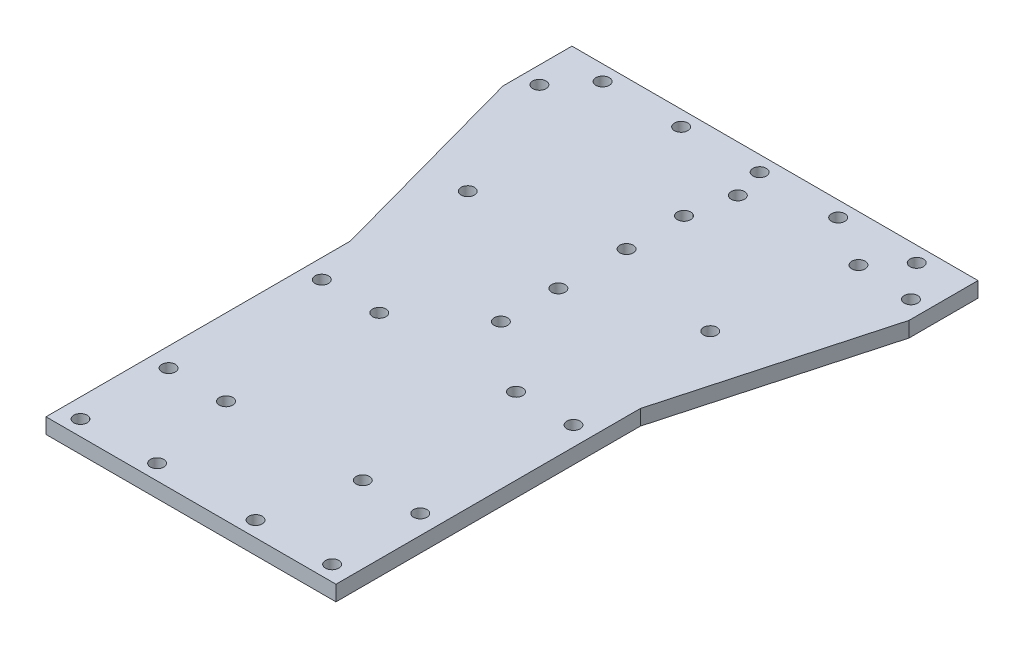
from build123d import *

# Parameters (mm, degrees)
SKETCH1_W           = 75.7
SKETCH1_H           = 42.7
SKETCH1_R           = 1.75
BOSS_EXTRUDE1_DEPTH = 4
SKETCH3_W           = 75.7
SKETCH3_H           = 29.75
SKETCH3_R           = 1.75
BOSS_EXTRUDE2_DEPTH = 4
SKETCH3_3_R         = 1.75
CUT_EXTRUDE1_DEPTH  = 4
SKETCH4_W           = 75.7
SKETCH4_H           = 50
SKETCH4_R           = 1.75
BOSS_EXTRUDE3_DEPTH = 4
SKETCH6_W           = 9
SKETCH6_H           = 8
BOSS_EXTRUDE4_DEPTH = 4
SKETCH6_3_R         = 1.75
CUT_EXTRUDE2_DEPTH  = 115.220007004
SKETCH7_W           = 15.15
SKETCH7_H           = 10
SKETCH7_R           = 1.75
BOSS_EXTRUDE5_DEPTH = 4
SKETCH8_W           = 75.7
SKETCH8_H           = 22
BOSS_EXTRUDE6_DEPTH = 4
SKETCH9_R           = 1.75
CUT_EXTRUDE3_DEPTH  = 135.08433913
BOSS_EXTRUDE7_DEPTH = 4


with BuildPart() as part:
    # Sketch1 → Boss-Extrude1 (new body)
    with BuildSketch(Plane(origin=(0, 0, 0), x_dir=(1, 0, 0), z_dir=(0, 1, 0))):
        Rectangle(SKETCH1_W, SKETCH1_H)
        with Locations((2.4, 17.25)):
            Circle(SKETCH1_R, mode=Mode.SUBTRACT)
        with Locations((-33.8, -17.05)):
            Circle(SKETCH1_R, mode=Mode.SUBTRACT)
        with Locations((29.5, -17.05)):
            Circle(SKETCH1_R, mode=Mode.SUBTRACT)
        with Locations((33.9, 17.25)):
            Circle(SKETCH1_R, mode=Mode.SUBTRACT)
    extrude(amount=BOSS_EXTRUDE1_DEPTH)

    # Sketch3 → Boss-Extrude2 (add)
    with BuildSketch(Plane(origin=(0, 4, 0), x_dir=(1, 0, 0), z_dir=(0, 1, 0))):
        with Locations((0, -36.225)):
            Rectangle(SKETCH3_W, SKETCH3_H)
        with Locations((0, -42.2)):
            Circle(SKETCH3_R, mode=Mode.SUBTRACT)
        with Locations((0, -27.2)):
            Circle(SKETCH3_R, mode=Mode.SUBTRACT)
    extrude(amount=-BOSS_EXTRUDE2_DEPTH)

    # Sketch3<3> → Cut-Extrude1 (cut)
    with BuildSketch(Plane(origin=(0, 4, 0), x_dir=(1, 0, 0), z_dir=(0, 1, 0))):
        with Locations((0, 5.6)):
            Circle(SKETCH3_3_R)
        with Locations((0, -9.4)):
            Circle(SKETCH3_3_R)
    extrude(amount=-CUT_EXTRUDE1_DEPTH, mode=Mode.SUBTRACT)

    # Sketch4 → Boss-Extrude3 (add)
    # profile 1 of 2: a face of its own
    with BuildSketch(Plane(origin=(0, 0, 0), x_dir=(1, 0, 0), z_dir=(0, 1, 0))):
        with Locations((0, -76.1)):
            Rectangle(SKETCH4_W, SKETCH4_H)
        with Locations((-32.85, -56.1)):
            Circle(SKETCH4_R, mode=Mode.SUBTRACT)
        with Locations((-17.85, -56.1)):
            Circle(SKETCH4_R, mode=Mode.SUBTRACT)
        with Locations((-17.85, -96.1)):
            Circle(SKETCH4_R, mode=Mode.SUBTRACT)
        with Locations((-32.85, -96.1)):
            Circle(SKETCH4_R, mode=Mode.SUBTRACT)
        with Locations((32.85, -96.1)):
            Circle(SKETCH4_R, mode=Mode.SUBTRACT)
        with Locations((17.85, -96.1)):
            Circle(SKETCH4_R, mode=Mode.SUBTRACT)
        with Locations((17.85, -56.1)):
            Circle(SKETCH4_R, mode=Mode.SUBTRACT)
        with Locations((32.85, -56.1)):
            Circle(SKETCH4_R, mode=Mode.SUBTRACT)
    # profile 2 of 2: a face of its own
    with BuildSketch(Plane(origin=(0, 0, 0), x_dir=(1, 0, 0), z_dir=(0, 1, 0))):
        Polygon((-37.85, 21.35), (-44, 21.35), (-44, 29.35), (44, 29.35), (44, 21.35), (37.85, 21.35), align=None)
    extrude(amount=BOSS_EXTRUDE3_DEPTH)

    # Sketch6 → Boss-Extrude4 (add)
    with BuildSketch(Plane(origin=(0, 4, 0), x_dir=(1, 0, 0), z_dir=(0, 1, 0))):
        with Locations((-48.5, 25.35)):
            Rectangle(SKETCH6_W, SKETCH6_H)
        with Locations((48.5, 25.35)):
            Rectangle(SKETCH6_W, SKETCH6_H)
    extrude(amount=-BOSS_EXTRUDE4_DEPTH)

    # Sketch6<3> → Cut-Extrude2 (cut, through all)
    with BuildSketch(Plane(origin=(0, 4, 0), x_dir=(1, 0, 0), z_dir=(0, 1, 0))):
        with Locations((0, 25.35)):
            Circle(SKETCH6_3_R)
        with Locations((20.5, 25.35)):
            Circle(SKETCH6_3_R)
        with Locations((41, 25.35)):
            Circle(SKETCH6_3_R)
        with Locations((-20.5, 25.35)):
            Circle(SKETCH6_3_R)
        with Locations((-41, 25.35)):
            Circle(SKETCH6_3_R)
    extrude(amount=-CUT_EXTRUDE2_DEPTH, mode=Mode.SUBTRACT)

    # Sketch7 → Boss-Extrude5 (add)
    # profile 1 of 2: a face of its own
    with BuildSketch(Plane(origin=(0, 0, 0), x_dir=(1, 0, 0), z_dir=(0, 1, 0))):
        with Locations((-45.425, 16.35)):
            Rectangle(SKETCH7_W, SKETCH7_H)
        with Locations((-48.5, 16.35)):
            Circle(SKETCH7_R, mode=Mode.SUBTRACT)
    # profile 2 of 2: a face of its own
    with BuildSketch(Plane(origin=(0, 0, 0), x_dir=(1, 0, 0), z_dir=(0, 1, 0))):
        with Locations((45.425, 16.35)):
            Rectangle(SKETCH7_W, SKETCH7_H)
        with Locations((48.5, 16.35)):
            Circle(SKETCH7_R, mode=Mode.SUBTRACT)
    extrude(amount=BOSS_EXTRUDE5_DEPTH)

    # Sketch8 → Boss-Extrude6 (add)
    with BuildSketch(Plane(origin=(0, 0, 0), x_dir=(1, 0, 0), z_dir=(0, 1, 0))):
        with Locations((0, -112.1)):
            Rectangle(SKETCH8_W, SKETCH8_H)
    extrude(amount=BOSS_EXTRUDE6_DEPTH)

    # Sketch9 → Cut-Extrude3 (cut, through all)
    with BuildSketch(Plane(origin=(0, 4, 0), x_dir=(1, 0, 0), z_dir=(0, 1, 0))):
        with Locations((-12.85, -119.1)):
            Circle(SKETCH9_R)
        with Locations((-32.85, -119.1)):
            Circle(SKETCH9_R)
    cut_extrude3 = extrude(amount=-CUT_EXTRUDE3_DEPTH, mode=Mode.SUBTRACT)

    # Mirror1: Cut-Extrude3 across plane
    add(cut_extrude3.mirror(Plane(origin=(0, 0, 0), x_dir=(0, 0, 1), z_dir=(1, 0, 0))), mode=Mode.SUBTRACT)

    # Sketch10 → Boss-Extrude7 (add)
    with BuildSketch(Plane(origin=(0, 4, 0), x_dir=(1, 0, 0), z_dir=(0, 1, 0))):
        Polygon((-53, 11.35), (-37.85, -43.65), (-37.85, 11.35), align=None)
        Polygon((53, 11.35), (37.85, -43.65), (37.85, 11.35), align=None)
    extrude(amount=-BOSS_EXTRUDE7_DEPTH)


solid = part.part
